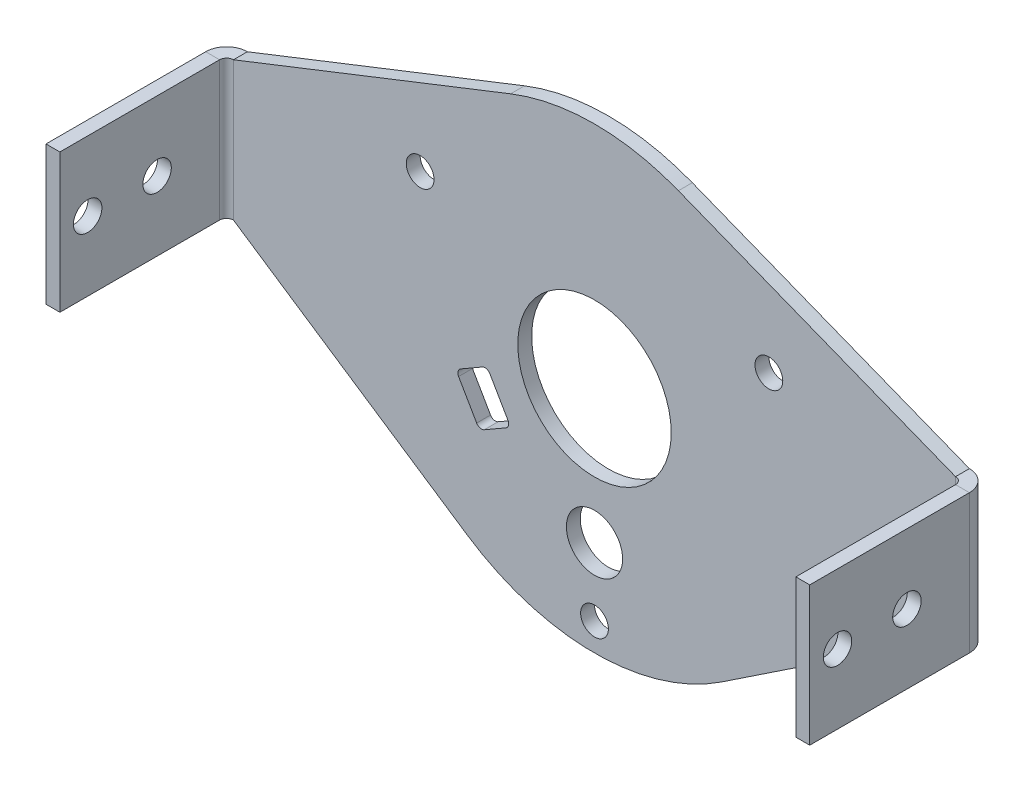
from build123d import *

# Parameters (mm, degrees)
SKETCH_1_R                  = 33
SKETCH_1_R_2                = 11.05
SKETCH_1_R_3                = 4.05
SKETCH_1_R_4                = 2
EXTRUDE_1_DEPTH             = 3
EXTRUDE_2_DEPTH             = 3
SHEET_METAL_1_OUTLINE_R     = 2
SHEET_METAL_1_OUTLINE_R_2   = 4.05
SHEET_METAL_1_OUTLINE_R_3   = 11.05
SHEET_METAL_1_DEPTH         = 1
SM_EDGE_FLANGE_1_DEPTH      = 20
SM_EDGE_FLANGE_1_BEND_DEPTH = 20
SKETCH_13_R                 = 2.05
CUT_EXTRUDE_1_DEPTH         = 118.974573532


# Read off the part's stored shape, not the designer's step: 转换实体1
# Sheet-metal steps are written as plain solids
with BuildPart() as part:
    # Sketch 1 → 凸台-拉伸1 (new body)
    with BuildSketch(Plane.XY):
        Circle(SKETCH_1_R)
        Circle(SKETCH_1_R_2, mode=Mode.SUBTRACT)
        with Locations((0, -19.25)):
            Circle(SKETCH_1_R_3, mode=Mode.SUBTRACT)
        with Locations((25.11473671, 14.5)):
            Circle(SKETCH_1_R_4, mode=Mode.SUBTRACT)
        with Locations((0, -29)):
            Circle(SKETCH_1_R_4, mode=Mode.SUBTRACT)
        with Locations((-25.11473671, 14.5)):
            Circle(SKETCH_1_R_4, mode=Mode.SUBTRACT)
        with BuildLine():
            Line((-19.57313602, -8.29833395), (-16.97313602, -12.80166605))
            ThreePointArc((-16.97313602, -12.80166605), (-16.487370933, -13.174406711), (-15.880315697, -13.094486373))
            Line((-15.880315697, -13.094486373), (-12.762624243, -11.294486373))
            ThreePointArc((-12.762624243, -11.294486373), (-12.389883582, -10.808721286), (-12.46980392, -10.20166605))
            Line((-12.46980392, -10.20166605), (-15.06980392, -5.69833395))
            ThreePointArc((-15.06980392, -5.69833395), (-15.555569007, -5.325593289), (-16.162624243, -5.405513627))
            Line((-16.162624243, -5.405513627), (-19.280315697, -7.205513627))
            ThreePointArc((-19.280315697, -7.205513627), (-19.653056358, -7.691278714), (-19.57313602, -8.29833395))
        make_face(mode=Mode.SUBTRACT)
    extrude(amount=EXTRUDE_1_DEPTH)

    # 草图3 → 凸台-拉伸2 (add)
    with BuildSketch(Plane.XY):
        with BuildLine():
            ThreePointArc((-18.301945503, -27.459766765), (-32.813072233, 3.507462139), (-12.084283208, 30.707818212))
            Line((-12.084283208, 30.707818212), (-52, 15))
            Line((-52, 15), (-52, -5))
            Line((-52, -5), (-18.301945503, -27.459766765))
        make_face()
        with BuildLine():
            ThreePointArc((18.301945503, -27.459766765), (32.813072233, 3.507462139), (12.084283208, 30.707818212))
            Line((12.084283208, 30.707818212), (52, 15))
            Line((52, 15), (52, -5))
            Line((52, -5), (18.301945503, -27.459766765))
        make_face()
    extrude(amount=EXTRUDE_2_DEPTH)

    # Sheet Metal 1 outline → Sheet Metal 1 (cut)
    with BuildSketch(Plane.XY):
        with BuildLine():
            ThreePointArc((-18.301945503, -27.459766765), (0, -33), (18.301945503, -27.459766765))
            Line((18.301945503, -27.459766765), (52, -5))
            Line((52, -5), (52, 15))
            Line((52, 15), (12.084283208, 30.707818212))
            ThreePointArc((12.084283208, 30.707818212), (0, 33), (-12.084283208, 30.707818212))
            Line((-12.084283208, 30.707818212), (-52, 15))
            Line((-52, 15), (-52, -5))
            Line((-52, -5), (-18.301945503, -27.459766765))
        make_face()
        with BuildLine():
            Line((-16.97313602, -12.80166605), (-19.57313602, -8.29833395))
            ThreePointArc((-19.57313602, -8.29833395), (-19.653056358, -7.691278714), (-19.280315697, -7.205513627))
            Line((-19.280315697, -7.205513627), (-16.162624243, -5.405513627))
            ThreePointArc((-16.162624243, -5.405513627), (-15.555569007, -5.325593289), (-15.06980392, -5.69833395))
            Line((-15.06980392, -5.69833395), (-12.46980392, -10.20166605))
            ThreePointArc((-12.46980392, -10.20166605), (-12.389883582, -10.808721286), (-12.762624243, -11.294486373))
            Line((-12.762624243, -11.294486373), (-15.880315697, -13.094486373))
            ThreePointArc((-15.880315697, -13.094486373), (-16.487370933, -13.174406711), (-16.97313602, -12.80166605))
        make_face(mode=Mode.SUBTRACT)
        with Locations((0, -29)):
            Circle(SHEET_METAL_1_OUTLINE_R, mode=Mode.SUBTRACT)
        with Locations((0, -19.25)):
            Circle(SHEET_METAL_1_OUTLINE_R_2, mode=Mode.SUBTRACT)
        with Locations((-25.11473671, 14.5)):
            Circle(SHEET_METAL_1_OUTLINE_R, mode=Mode.SUBTRACT)
        Circle(SHEET_METAL_1_OUTLINE_R_3, mode=Mode.SUBTRACT)
        with Locations((25.11473671, 14.5)):
            Circle(SHEET_METAL_1_OUTLINE_R, mode=Mode.SUBTRACT)
    extrude(amount=SHEET_METAL_1_DEPTH, mode=Mode.SUBTRACT)

    # 边线-法兰1 section (across the edge) → 边线-法兰1 (add)
    with BuildSketch(Plane(origin=(53, -5, 3), x_dir=(-1, 0, 0), z_dir=(0, 1, 0))):
        with BuildLine():
            Line((-2, 1), (-2, 24))
            Line((-2, 24), (0, 24))
            Line((0, 24), (0, 1))
            ThreePointArc((0, 1), (0.292893219, 0.292893219), (1, 0))
            Line((1, 0), (1, -2))
            ThreePointArc((1, -2), (-1.121320344, -1.121320344), (-2, 1))
        make_face()
    extrude(amount=SM_EDGE_FLANGE_1_DEPTH)

    # 边线-法兰1 section 2 (across the edge) → 边线-法兰1 bend (add)
    with BuildSketch(Plane(origin=(-53, 15, 3), x_dir=(1, 0, 0), z_dir=(0, -1, 0))):
        with BuildLine():
            Line((-2, 1), (-2, 24))
            Line((-2, 24), (0, 24))
            Line((0, 24), (0, 1))
            ThreePointArc((0, 1), (0.292893219, 0.292893219), (1, 0))
            Line((1, 0), (1, -2))
            ThreePointArc((1, -2), (-1.121320344, -1.121320344), (-2, 1))
        make_face()
    extrude(amount=SM_EDGE_FLANGE_1_BEND_DEPTH)

    # 草图13 → 切除-拉伸1 (cut, through all)
    with BuildSketch(Plane(origin=(55, 0, 0), x_dir=(0, 0, -1), z_dir=(1, 0, 0))):
        with Locations((-23, 5)):
            Circle(SKETCH_13_R)
        with Locations((-13, 5)):
            Circle(SKETCH_13_R)
    extrude(amount=-CUT_EXTRUDE_1_DEPTH, mode=Mode.SUBTRACT)


solid = part.part
